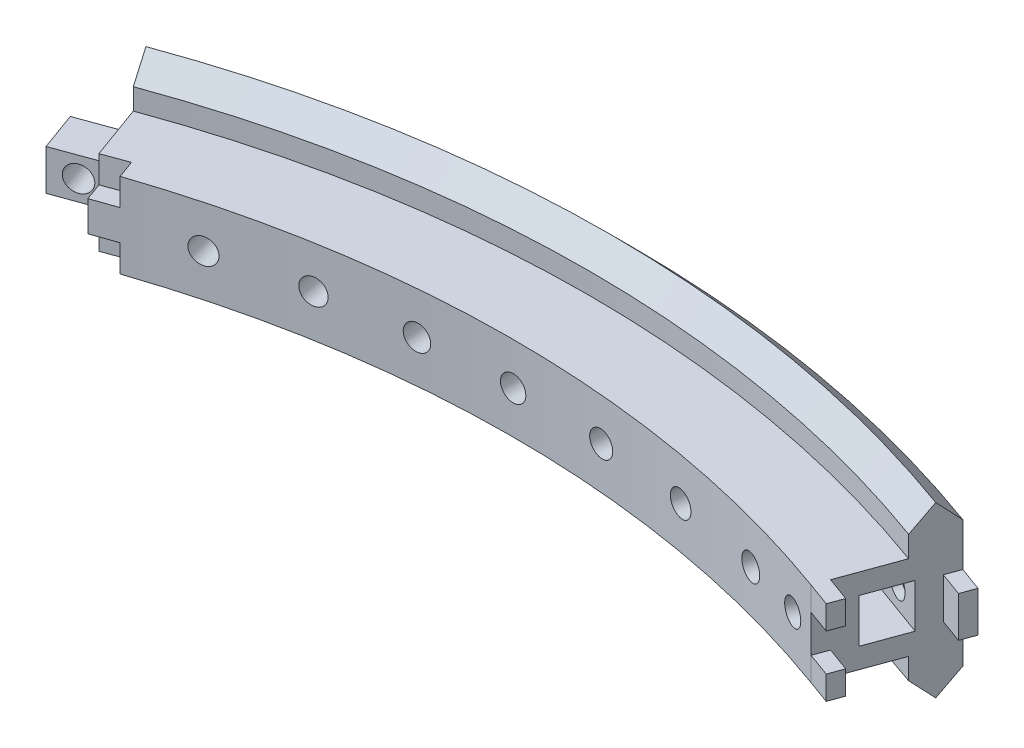
from build123d import *

# Parameters (mm, degrees)
REVOLVE_1_ANGLE          = 40
SKETCH_3_W               = 5.2
SKETCH_3_H               = 5.2
CUT_EXTRUDE_1_DEPTH      = 7
SKETCH_4_W               = 4.8
SKETCH_4_H               = 4.8
EXTRUDE_1_DEPTH          = 6
CUT_EXTRUDE_2_DEPTH      = 98.941918912
CUT_EXTRUDE_2_DEPTH_BACK = 98.941918912
SKETCH_5_R               = 1.5
CUT_EXTRUDE_START        = -1
SKETCH_6_R               = 3
CUT_EXTRUDE_3_DEPTH      = 98.947267083
SKETCH_7_R               = 1.5
CUT_EXTRUDE_4_DEPTH      = 95.895882318
SKETCH_11_R              = 1.5
CUT_EXTRUDE_6_DEPTH      = 57.807113078
CUT_EXTRUDE_7_DEPTH      = 5
PATTERN_CIRCULAR_1_COUNT = 4
PATTERN_CIRCULAR_1_ANGLE = 15
F_1_THE_OTHER_WAY_COUNT  = 4
F_1_THE_OTHER_WAY_ANGLE  = 15
SKETCH_9_W               = 1.8
SKETCH_9_H               = 4.8
SKETCH_9_H_2             = 2.8
EXTRUDE_2_DEPTH          = 3
SKETCH_10_W              = 2.2
SKETCH_10_H              = 5.2
CUT_EXTRUDE_5_DEPTH      = 3


# Read off the part's stored shape, not the designer's step: 旋转1
with BuildPart() as part:
    # 旋转1 outline → 旋转1 (revolve)
    with BuildSketch(Plane(origin=(0, 0, 0), x_dir=(0.3420201433256701, 0, -0.9396926207859079), z_dir=(0.9396926207859079, 0, 0.3420201433256701))):
        Polygon((134, 5), (125, 5), (125, -5), (134, -5), (134, -7.5), (136.5, -10), (139, -7.5), (139, 7.5), (136.5, 10), (134, 7.5), align=None)
    revolve(axis=Axis((0, 0, 0), (0, 1, 0)), revolution_arc=REVOLVE_1_ANGLE)

    # 草图3 → 切除-拉伸1 (cut)
    with BuildSketch(Plane(origin=(0, 0, 0), x_dir=(0.34202014332566943, 0, -0.9396926207859081), z_dir=(0.9396926207859081, 0, 0.34202014332566943))):
        with Locations((132, 0)):
            Rectangle(SKETCH_3_W, SKETCH_3_H)
    extrude(amount=-CUT_EXTRUDE_1_DEPTH, mode=Mode.SUBTRACT)

    # 草图4 → 凸台-拉伸1 (add)
    with BuildSketch(Plane(origin=(0, 0, 0), x_dir=(0.3420201433256631, 0, 0.9396926207859104), z_dir=(-0.9396926207859104, 0, 0.3420201433256631))):
        with Locations((-132, 0)):
            Rectangle(SKETCH_4_W, SKETCH_4_H)
    extrude(amount=EXTRUDE_1_DEPTH)

    # 草图5 → 切除-拉伸2 (cut, two sides: drawn at the far end of the back side and taken through both)
    with BuildSketch(Plane(origin=(44.257406546, 0, -121.59622513), x_dir=(-0.9396926207859081, 0, -0.3420201433256695), z_dir=(0.3420201433256695, 0, -0.9396926207859081)).offset(-CUT_EXTRUDE_2_DEPTH_BACK)):
        with Locations((3.5, 0)):
            Circle(SKETCH_5_R)
    extrude(amount=CUT_EXTRUDE_2_DEPTH + CUT_EXTRUDE_2_DEPTH_BACK, mode=Mode.SUBTRACT)

    # 草图6 → 切除-拉伸3 (cut, through all)
    with BuildSketch(Plane(origin=(46.035911292, 0, -126.482626758), x_dir=(0.9396926207859081, 0, 0.3420201433256695), z_dir=(-0.3420201433256695, 0, 0.9396926207859081)).offset(CUT_EXTRUDE_START)):
        with Locations((-3.5, 0)):
            Circle(SKETCH_6_R)
    extrude(amount=-CUT_EXTRUDE_3_DEPTH, mode=Mode.SUBTRACT)

    # 草图7 → 切除-拉伸4 (cut, through all)
    with BuildSketch(Plane(origin=(-45.967507263, 0, -126.294688234), x_dir=(-0.9396926207859105, 0, 0.3420201433256632), z_dir=(-0.3420201433256632, 0, -0.9396926207859105))):
        with Locations((3, 0)):
            Circle(SKETCH_7_R)
    extrude(amount=-CUT_EXTRUDE_4_DEPTH, mode=Mode.SUBTRACT)

    # 草图11 → 切除-拉伸6 (cut, through all)
    with BuildSketch(Plane(origin=(0, 0, -139), x_dir=(-1, 0, 0), z_dir=(0, 0, -1))):
        Circle(SKETCH_11_R)
    cut_extrude_6 = extrude(amount=-CUT_EXTRUDE_6_DEPTH, mode=Mode.SUBTRACT)

    # 草图12 → 切除-拉伸7 (cut)
    with BuildSketch(Plane(origin=(0, 0, -139), x_dir=(-1, 0, 0), z_dir=(0, 0, -1))):
        Polygon((0, -3.175426481), (2.75, -1.58771324), (2.75, 1.58771324), (0, 3.175426481), (-2.75, 1.58771324), (-2.75, -1.58771324), align=None)
    cut_extrude_7 = extrude(amount=-CUT_EXTRUDE_7_DEPTH, mode=Mode.SUBTRACT)

    # 阵列(圆周)1: 切除-拉伸6, 切除-拉伸7 ×4 about axis
    pattern_circular_1_axis = Axis((0, 0, 0), (0, -1, 0))
    add([cut_extrude_6.rotate(pattern_circular_1_axis, i * PATTERN_CIRCULAR_1_ANGLE / (PATTERN_CIRCULAR_1_COUNT - 1)) for i in range(1, PATTERN_CIRCULAR_1_COUNT)], mode=Mode.SUBTRACT)
    add([cut_extrude_7.rotate(pattern_circular_1_axis, i * PATTERN_CIRCULAR_1_ANGLE / (PATTERN_CIRCULAR_1_COUNT - 1)) for i in range(1, PATTERN_CIRCULAR_1_COUNT)], mode=Mode.SUBTRACT)

    # 1 the other way: 切除-拉伸6, 切除-拉伸7 ×4 about axis
    f_1_the_other_way_axis = Axis((0, 0, 0), (0, 1, 0))
    add([cut_extrude_6.rotate(f_1_the_other_way_axis, i * F_1_THE_OTHER_WAY_ANGLE / (F_1_THE_OTHER_WAY_COUNT - 1)) for i in range(1, F_1_THE_OTHER_WAY_COUNT)], mode=Mode.SUBTRACT)
    add([cut_extrude_7.rotate(f_1_the_other_way_axis, i * F_1_THE_OTHER_WAY_ANGLE / (F_1_THE_OTHER_WAY_COUNT - 1)) for i in range(1, F_1_THE_OTHER_WAY_COUNT)], mode=Mode.SUBTRACT)

    # 草图9 → 凸台-拉伸2 (add)
    with BuildSketch(Plane(origin=(0, 0, 0), x_dir=(0.34202014332566943, 0, -0.9396926207859082), z_dir=(0.9396926207859082, 0, 0.34202014332566943))):
        with Locations((138.1, 0)):
            Rectangle(SKETCH_9_W, SKETCH_9_H)
        with Locations((125.9, 3.6)):
            Rectangle(SKETCH_9_W, SKETCH_9_H_2)
        with Locations((125.9, -3.6)):
            Rectangle(SKETCH_9_W, SKETCH_9_H_2)
    extrude(amount=EXTRUDE_2_DEPTH)

    # 草图10 → 切除-拉伸5 (cut)
    with BuildSketch(Plane(origin=(0, 0, 0), x_dir=(0.3420201433256631, 0, 0.9396926207859104), z_dir=(-0.9396926207859104, 0, 0.3420201433256631))):
        with Locations((-137.9, 0)):
            Rectangle(SKETCH_10_W, SKETCH_10_H)
        Polygon((-127.2, 5), (-125, 5), (-123.655375964, 5), (-123.655375964, 1.8), (-125, 1.8), (-127.2, 1.8), align=None)
        Polygon((-127.2, -1.8), (-125, -1.8), (-123.655375964, -1.8), (-123.655375964, -5), (-125, -5), (-127.2, -5), align=None)
    extrude(amount=-CUT_EXTRUDE_5_DEPTH, mode=Mode.SUBTRACT)


solid = part.part
